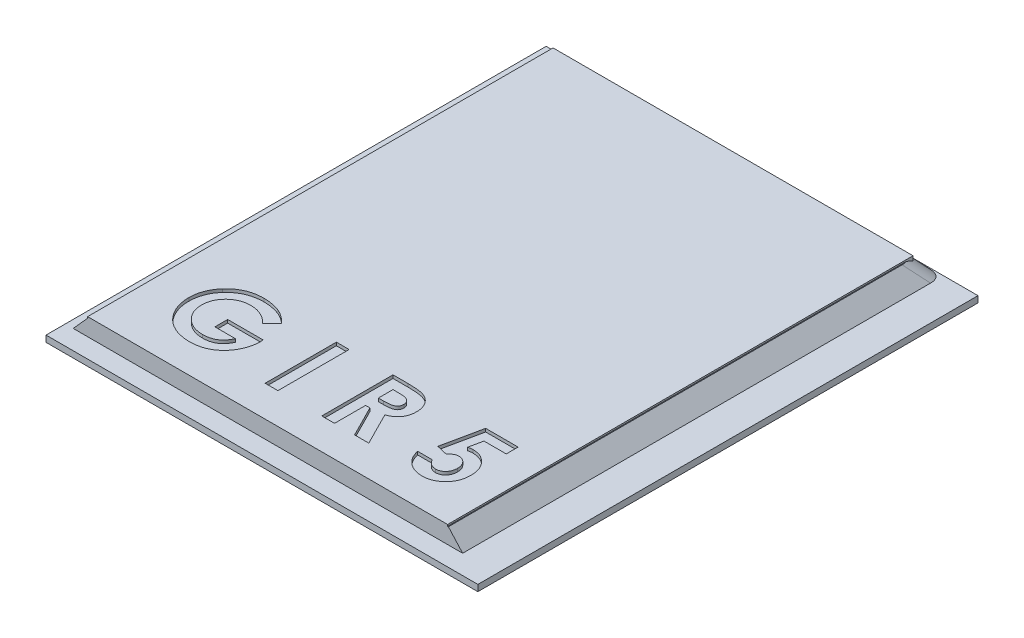
from build123d import *
from OCP.BRepAlgoAPI import BRepAlgoAPI_Cut
from OCP.TopTools import TopTools_ListOfShape

# Parameters (mm, degrees)
EXTRUDE_1_DEPTH      = 29.4
SKETCH_3_W           = 22.739
SKETCH_3_H           = 29.4
EXTRUDE_2_DEPTH      = 0.1
SKETCH_5_W           = 27.278449002
SKETCH_5_H           = 31.591708033
EXTRUDE_3_DEPTH      = 0.4
EXTRUDE_4_DEPTH      = 18.278488
EXTRUDE_4_DEPTH_BACK = 6.321512
CUT_EXTRUDE_5_DEPTH  = 10.4
FILLET_1_R           = 1
SKETCH_8_W           = 0.807692308
SKETCH_8_H           = 4.5
CUT_EXTRUDE_6_DEPTH  = 0.2


with BuildPart() as part:
    # Эскиз1 → Бобышка-Вытянуть1 (new body)
    with BuildSketch(Plane.XY):
        Polygon((0, 4.813517442), (17.378488372, 4.813517442), (18.278488372, 3.813517442), (-6.321511628, 3.813517442), (-5.421511628, 4.813517442), align=None)
    extrude(amount=EXTRUDE_1_DEPTH)

    # Эскиз3 → Бобышка-Вытянуть2 (add)
    with BuildSketch(Plane(origin=(0, 4.813517442, 0), x_dir=(1, 0, 0), z_dir=(0, 1, 0))):
        with Locations((5.957988372, -14.7)):
            Rectangle(SKETCH_3_W, SKETCH_3_H)
    extrude(amount=EXTRUDE_2_DEPTH)

    # Эскиз6 → Бобышка-Вытянуть4 (add, two sides: drawn at the far end of the back side and taken through both)
    with BuildSketch(Plane(origin=(0, 0, 0), x_dir=(0, 0, -1), z_dir=(1, 0, 0)).offset(-EXTRUDE_4_DEPTH_BACK)):
        Polygon((0, 4.813517442), (0.9, 3.809289797), (0, 3.813517442), align=None)
    extrude(amount=EXTRUDE_4_DEPTH + EXTRUDE_4_DEPTH_BACK)


with BuildPart() as body_2:
    # Эскиз5 → Бобышка-Вытянуть3 (new body)
    with BuildSketch(Plane(origin=(0, 3.593517442, 0), x_dir=(-1, 0, 0), z_dir=(0, -1, 0))):
        with Locations((-6.601803286, -14.606740346)):
            Rectangle(SKETCH_5_W, SKETCH_5_H)
    extrude(amount=EXTRUDE_3_DEPTH)


with BuildPart() as cut_extrude_5_tool:
    # Эскиз7 → Вырез-Вытянуть5 (new body)
    with BuildSketch(Plane.XY):
        Polygon((-5.421511628, 4.813517442), (-6.321511628, 3.813517442), (-6.321511628, 4.813517442), align=None)
        Polygon((17.378488372, 4.813517442), (18.278488372, 4.813517442), (18.278488372, 3.813517442), align=None)
    extrude(amount=-CUT_EXTRUDE_5_DEPTH)


with BuildPart() as part_1:
    add(part.part)

    # Вырез-Вытянуть5: cut by cut_extrude_5_tool, with a tolerance
    cut_extrude_5_stock = TopTools_ListOfShape()
    cut_extrude_5_stock.Append(part_1.part.wrapped)
    cut_extrude_5_tools = TopTools_ListOfShape()
    cut_extrude_5_tools.Append(cut_extrude_5_tool.part.wrapped)
    cut_extrude_5_cut = BRepAlgoAPI_Cut()
    cut_extrude_5_cut.SetArguments(cut_extrude_5_stock)
    cut_extrude_5_cut.SetTools(cut_extrude_5_tools)
    cut_extrude_5_cut.SetFuzzyValue(0.00001)
    cut_extrude_5_cut.Build()
    add(Compound.cast(cut_extrude_5_cut.Shape()).solids(), mode=Mode.REPLACE)

    # Скругление1
    # the kernel refuses this fillet: 1 mm, written as the material it takes off along each edge
    with BuildSketch(Plane(origin=(16.51746979, 5.770204755, 0.857393826), x_dir=(0.37087511946776647, -0.4120834660752991, 0.8322492792109453), z_dir=(0.5567454157103284, -0.6186060174559179, -0.5544016028592109))) as fillet_1_piece_1_section:
        with BuildLine():
            CenterArc((FILLET_1_R * 0.618608475228, FILLET_1_R), FILLET_1_R, 206.517427438, 63.482572562)
            Line((-FILLET_1_R * 0.276190126695, FILLET_1_R * 0.553529998772), (0, 0))
            Line((0, 0), (FILLET_1_R * 0.618608475228, 0))
        make_face()
    fillet_1_piece_1 = extrude(amount=4.709579491, mode=Mode.PRIVATE)
    fillet_1_piece_1 = split(fillet_1_piece_1, bisect_by=Plane(origin=(16.51746979, 5.770204755, 0), z_dir=(0, 0, -1)), keep=Keep.TOP, mode=Mode.PRIVATE)
    add(fillet_1_piece_1, mode=Mode.SUBTRACT)
    with BuildSketch(Plane(origin=(16.51746979, 5.770204755, 0.857393826), x_dir=(0.37087511946776647, -0.4120834660752991, 0.8322492792109453), z_dir=(0.5567454157103284, -0.6186060174559179, -0.5544016028592109))) as fillet_1_piece_2_section:
        with BuildLine():
            CenterArc((FILLET_1_R * 0.618608475228, FILLET_1_R), FILLET_1_R, 206.517427438, 63.482572562)
            Line((-FILLET_1_R * 0.276190126695, FILLET_1_R * 0.553529998772), (0, 0))
            Line((0, 0), (FILLET_1_R * 0.618608475228, 0))
        make_face()
    fillet_1_piece_2 = extrude(amount=4.709579491, mode=Mode.PRIVATE)
    fillet_1_piece_2 = split(fillet_1_piece_2, bisect_by=Plane(origin=(17.327488372, 5.770204755, 0.857393826), z_dir=(1, 0, 0)), keep=Keep.TOP, mode=Mode.PRIVATE)
    add(fillet_1_piece_2, mode=Mode.SUBTRACT)
    with BuildSketch(Plane(origin=(-7.18253021, 2.856830129, -1.753604963), x_dir=(0.8306831779237713, -0.4146058009868712, -0.3715743367113758), z_dir=(0.5567454157103263, 0.618606017455919, 0.5544016028592119))) as fillet_1_piece_3_section:
        with BuildLine():
            CenterArc((FILLET_1_R * 0.618608475228, -FILLET_1_R), FILLET_1_R, 90, 63.482572562)
            Line((-FILLET_1_R * 0.276190126695, -FILLET_1_R * 0.553529998772), (0, 0))
            Line((0, 0), (FILLET_1_R * 0.618608475228, 0))
        make_face()
    fillet_1_piece_3 = extrude(amount=4.709580159, mode=Mode.PRIVATE)
    fillet_1_piece_3 = split(fillet_1_piece_3, bisect_by=Plane(origin=(-7.18253021, 2.856830129, 0), z_dir=(0, 0, -1)), keep=Keep.TOP, mode=Mode.PRIVATE)
    add(fillet_1_piece_3, mode=Mode.SUBTRACT)
    with BuildSketch(Plane(origin=(-7.18253021, 2.856830129, -1.753604963), x_dir=(0.8306831779237713, -0.4146058009868712, -0.3715743367113758), z_dir=(0.5567454157103263, 0.618606017455919, 0.5544016028592119))) as fillet_1_piece_4_section:
        with BuildLine():
            CenterArc((FILLET_1_R * 0.618608475228, -FILLET_1_R), FILLET_1_R, 90, 63.482572562)
            Line((-FILLET_1_R * 0.276190126695, -FILLET_1_R * 0.553529998772), (0, 0))
            Line((0, 0), (FILLET_1_R * 0.618608475228, 0))
        make_face()
    fillet_1_piece_4 = extrude(amount=4.709580159, mode=Mode.PRIVATE)
    fillet_1_piece_4 = split(fillet_1_piece_4, bisect_by=Plane(origin=(-5.411511628, 2.856830129, -1.753604963), z_dir=(-1, 0, 0)), keep=Keep.TOP, mode=Mode.PRIVATE)
    add(fillet_1_piece_4, mode=Mode.SUBTRACT)

    # Эскиз8 → Вырез-Вытянуть6 (cut)
    # profile 1 of 4: a face of its own
    with BuildSketch(Plane(origin=(0, 4.913517442, 0), x_dir=(1, 0, 0), z_dir=(0, 1, 0))):
        with BuildLine():
            Line((1.098326493, -23.654828716), (0.487148608, -24.239864774))
            add(Edge.make_bspline(
                [(0.487148608, -24.239864774), (0.438760589, -24.191418777), (0.343815306, -24.096359733), (0.188544172, -23.972633854), (0.027730402, -23.867442397), (-0.139155309, -23.780946624), (-0.312345432, -23.713852982), (-0.49149819, -23.665858753), (-0.676905041, -23.637392562), (-0.802417203, -23.633407393), (-0.865916296, -23.631391216)],
                knots=[0, 0, 0, 0, 1.075575784, 2.110457258, 3.113929901, 4.09197124, 5.059417775, 6.02750972, 7.002078037, 8, 8, 8, 8], degree=3))
            add(Edge.make_bspline(
                [(-0.865916296, -23.631391216), (-0.920968068, -23.632803942), (-1.029067048, -23.635577953), (-1.187908088, -23.6566436), (-1.339690432, -23.691832817), (-1.485131161, -23.740581602), (-1.623342311, -23.804019178), (-1.755124703, -23.881166461), (-1.879667345, -23.972613635), (-1.995989555, -24.076627178), (-2.101901302, -24.190188967), (-2.194367849, -24.311740237), (-2.273129482, -24.439015375), (-2.337966369, -24.572665541), (-2.38730019, -24.712485608), (-2.422518082, -24.858374073), (-2.444872686, -25.009906964), (-2.447512097, -25.113284272), (-2.448848988, -25.165646024)],
                knots=[0, 0, 0, 0, 1.075001177, 2.110859044, 3.123021556, 4.114053297, 5.101481495, 6.087880186, 7.091499647, 8.114004866, 9.131394192, 10.11971144, 11.092043119, 12.050101265, 13.015322563, 13.981809771, 14.977764287, 16, 16, 16, 16], degree=3))
            add(Edge.make_bspline(
                [(-2.448848988, -25.165646024), (-2.447602, -25.219820086), (-2.445145263, -25.326550405), (-2.421545529, -25.483181737), (-2.385186075, -25.633872365), (-2.331965529, -25.777504199), (-2.266467154, -25.916044796), (-2.183404424, -26.046810492), (-2.086544968, -26.171798223), (-1.976061862, -26.28883188), (-1.855884773, -26.396708747), (-1.725729076, -26.489766108), (-1.589554905, -26.570054524), (-1.445164403, -26.633640354), (-1.295063761, -26.68469281), (-1.137730527, -26.720689173), (-0.973518979, -26.742772816), (-0.861478919, -26.74542821), (-0.804618219, -26.746775832)],
                knots=[0, 0, 0, 0, 1.022067601, 2.013613092, 2.983553406, 3.943623673, 4.90013463, 5.87121881, 6.861774014, 7.881098904, 8.905697761, 9.905387765, 10.89678721, 11.884561068, 12.87834324, 13.885584958, 14.926927371, 16, 16, 16, 16], degree=3))
            add(Edge.make_bspline(
                [(-0.804618219, -26.746775832), (-0.767632439, -26.746442115), (-0.695021123, -26.745786956), (-0.588512696, -26.735151877), (-0.486503206, -26.719947796), (-0.388597597, -26.699819398), (-0.295784454, -26.671334103), (-0.206778714, -26.638024058), (-0.122101874, -26.598711563), (-0.042213042, -26.552040264), (0.034076759, -26.499727443), (0.106053442, -26.439870451), (0.174979563, -26.373818843), (0.240049729, -26.300765706), (0.300162608, -26.220057857), (0.357244064, -26.133178412), (0.410640525, -26.039265145), (0.442191085, -25.972948352), (0.458302454, -25.939083524)],
                knots=[0, 0, 0, 0, 1.109579412, 2.178351274, 3.208885622, 4.204702371, 5.174744997, 6.119429583, 7.05542196, 7.97267548, 8.893247984, 9.828544973, 10.778894627, 11.756245826, 12.760884819, 13.796418446, 14.874735809, 16, 16, 16, 16], degree=3))
            Line((0.458302454, -25.939083524), (-0.833464373, -25.939083524))
            Line((-0.833464373, -25.939083524), (-0.833464373, -25.131391216))
            Line((-0.833464373, -25.131391216), (1.410225531, -25.131391216))
            Line((1.410225531, -25.131391216), (1.416535627, -25.323398428))
            add(Edge.make_bspline(
                [(1.416535627, -25.323398428), (1.415724827, -25.372710751), (1.414104673, -25.471247397), (1.399298166, -25.617951675), (1.374771413, -25.762710225), (1.341240994, -25.905377656), (1.299218896, -26.046653801), (1.245627568, -26.185185825), (1.182872449, -26.321913205), (1.112559791, -26.456254956), (1.033548595, -26.585159519), (0.94848144, -26.707215124), (0.858571017, -26.822210518), (0.761861812, -26.928543528), (0.659859746, -27.027107399), (0.552364027, -27.117522942), (0.438994449, -27.199866662), (0.320351574, -27.274834173), (0.195759618, -27.340538774), (0.065903586, -27.39769306), (-0.069020456, -27.446232988), (-0.20936085, -27.48602517), (-0.354841441, -27.516728004), (-0.505465347, -27.537780978), (-0.661315291, -27.55208671), (-0.767025012, -27.553664733), (-0.82084418, -27.554468139)],
                knots=[0, 0, 0, 0, 1.006889344, 2.011981806, 3.007738725, 4.003571281, 5.003404394, 6.015442001, 7.03424805, 8.074616296, 9.110249922, 10.119753985, 11.111721717, 12.089233633, 13.052717867, 14.006597561, 14.955430184, 15.912305663, 16.870361111, 17.829300583, 18.807640451, 19.796414044, 20.806216501, 21.841577364, 22.90109906, 24, 24, 24, 24], degree=3))
            add(Edge.make_bspline(
                [(-0.82084418, -27.554468139), (-0.878265584, -27.55367476), (-0.992091933, -27.552102047), (-1.160399445, -27.537372513), (-1.323824252, -27.513062369), (-1.482407115, -27.47941796), (-1.636516232, -27.437544806), (-1.785886819, -27.384984092), (-1.930213374, -27.322461461), (-2.069928086, -27.251632536), (-2.20324525, -27.171306366), (-2.329866079, -27.082891478), (-2.449099455, -26.985819142), (-2.562166696, -26.881714368), (-2.666426114, -26.768018251), (-2.765763051, -26.648416235), (-2.855364971, -26.518521793), (-2.939084492, -26.382546143), (-3.013461584, -26.240546266), (-3.078505419, -26.095148521), (-3.133974765, -25.947194763), (-3.177713686, -25.795996069), (-3.213225592, -25.642606724), (-3.238635028, -25.486359673), (-3.252984924, -25.327274474), (-3.255350576, -25.220360979), (-3.256541296, -25.166547466)],
                knots=[0, 0, 0, 0, 1.084149091, 2.14910686, 3.187506334, 4.202448172, 5.208724393, 6.201130722, 7.189831603, 8.176984443, 9.156919086, 10.126598231, 11.090766514, 12.05840148, 13.026036446, 14.001772938, 14.991905635, 16.003017641, 17.015720547, 18.016462227, 19.009322657, 19.99686681, 20.986544154, 21.980959929, 22.983742515, 24, 24, 24, 24], degree=3))
            add(Edge.make_bspline(
                [(-3.256541296, -25.166547466), (-3.254946667, -25.093134335), (-3.251797749, -24.948165166), (-3.222633988, -24.73462466), (-3.17717203, -24.528045528), (-3.111929543, -24.329180116), (-3.028208025, -24.137754486), (-2.927193468, -23.953319256), (-2.806691616, -23.776070465), (-2.713414906, -23.666328845), (-2.666096584, -23.610658043)],
                knots=[0, 0, 0, 0, 1.034044851, 2.041932006, 3.031217818, 4.011390712, 4.986069675, 5.97149666, 6.970960976, 8, 8, 8, 8], degree=3))
            add(Edge.make_bspline(
                [(-2.666096584, -23.610658043), (-2.6367171, -23.578450796), (-2.578399267, -23.514519896), (-2.485178316, -23.42568661), (-2.389593256, -23.342180034), (-2.290320218, -23.265770874), (-2.187881062, -23.194786496), (-2.081980951, -23.130557558), (-1.973175411, -23.071038978), (-1.860615892, -23.01927), (-1.744891657, -22.972854792), (-1.625490184, -22.933581), (-1.503305763, -22.898793756), (-1.377256448, -22.872329584), (-1.248615638, -22.850292242), (-1.116470198, -22.835521662), (-0.981180231, -22.824695877), (-0.889676901, -22.82403386), (-0.843380238, -22.823698908)],
                knots=[0, 0, 0, 0, 1.020590567, 2.025856924, 3.013483481, 3.991664875, 4.957826714, 5.930500614, 6.890802512, 7.860442893, 8.829981142, 9.809047939, 10.802672283, 11.803273349, 12.823572789, 13.857849586, 14.916166035, 16, 16, 16, 16], degree=3))
            add(Edge.make_bspline(
                [(-0.843380238, -22.823698908), (-0.794985194, -22.824445243), (-0.698696827, -22.825930176), (-0.55553197, -22.836204938), (-0.414356485, -22.852056474), (-0.275765299, -22.875834683), (-0.139293299, -22.905158164), (-0.005646897, -22.942728801), (0.126045784, -22.985415812), (0.21177722, -23.019449051), (0.254576493, -23.036439293)],
                knots=[0, 0, 0, 0, 1.03180557, 2.052914215, 3.058998889, 4.059601663, 5.049854447, 6.033765722, 7.018406786, 8, 8, 8, 8], degree=3))
            add(Edge.make_bspline(
                [(0.254576493, -23.036439293), (0.290586786, -23.052141335), (0.363830727, -23.084078854), (0.470391633, -23.142510043), (0.577212897, -23.207287722), (0.683141862, -23.280780313), (0.788017123, -23.362850352), (0.89293369, -23.452201556), (0.996820535, -23.549875811), (1.064052982, -23.619391343), (1.098326493, -23.654828716)],
                knots=[0, 0, 0, 0, 0.894392155, 1.819168899, 2.76525314, 3.739198753, 4.75366411, 5.797420238, 6.877176959, 8, 8, 8, 8], degree=3))
        make_face()
    # profile 2 of 4: a face of its own
    with BuildSketch(Plane(origin=(0, 4.913517442, 0), x_dir=(1, 0, 0), z_dir=(0, 1, 0))):
        with Locations((4.243458704, -25.189083524)):
            Rectangle(SKETCH_8_W, SKETCH_8_H)
    # profile 3 of 4: a face of its own
    with BuildSketch(Plane(origin=(0, 4.913517442, 0), x_dir=(1, 0, 0), z_dir=(0, 1, 0))):
        with BuildLine():
            Line((7.416535627, -22.939083524), (8.357641397, -22.939083524))
            add(Edge.make_bspline(
                [(8.357641397, -22.939083524), (8.419848202, -22.939304322), (8.53948941, -22.93972898), (8.712005498, -22.946428952), (8.87048525, -22.955752514), (9.015163309, -22.969980517), (9.145977779, -22.988845128), (9.263059768, -23.011083383), (9.366405853, -23.036428643), (9.456887615, -23.068010836), (9.538542932, -23.103635071), (9.614657039, -23.14456797), (9.686909127, -23.190353733), (9.754816269, -23.242197107), (9.818968595, -23.299165442), (9.87948713, -23.361316082), (9.935516693, -23.42917604), (9.986710345, -23.502316526), (10.033369239, -23.579258641), (10.074605915, -23.660108025), (10.108139648, -23.744920905), (10.137770296, -23.832471551), (10.159112292, -23.924011517), (10.173955338, -24.018649645), (10.184822835, -24.116719072), (10.185447665, -24.183343087), (10.185766397, -24.217328716)],
                knots=[0, 0, 0, 0, 1.749336639, 3.364467119, 4.854658419, 6.213483162, 7.451590619, 8.570285859, 9.5643256, 10.440900261, 11.26203566, 12.067320669, 12.869050712, 13.665104639, 14.467235401, 15.27997916, 16.102287765, 16.939272006, 17.78853747, 18.631303466, 19.488103222, 20.351255419, 21.228522269, 22.127379805, 23.044756219, 24, 24, 24, 24], degree=3))
            add(Edge.make_bspline(
                [(10.185766397, -24.217328716), (10.184938445, -24.252801906), (10.183314984, -24.322358365), (10.174570135, -24.424531131), (10.1585873, -24.522282887), (10.134378971, -24.615327428), (10.106554641, -24.704822801), (10.069555419, -24.789117761), (10.02779814, -24.869438256), (9.97820424, -24.944648122), (9.923777358, -25.016417921), (9.860480039, -25.081997884), (9.792412977, -25.144912688), (9.715749875, -25.201221562), (9.633870113, -25.254731909), (9.545146826, -25.303226534), (9.450159055, -25.347924479), (9.383377947, -25.372851141), (9.349227935, -25.385597947)],
                knots=[0, 0, 0, 0, 1.099860209, 2.156625411, 3.176576793, 4.16617041, 5.135385252, 6.078461593, 7.016046972, 7.938469504, 8.868247731, 9.803980173, 10.76021508, 11.73834243, 12.748633912, 13.790971185, 14.870363756, 16, 16, 16, 16], degree=3))
            Line((9.349227935, -25.385597947), (10.387689474, -27.439083524))
            Line((10.387689474, -27.439083524), (9.489852935, -27.439083524))
            Line((9.489852935, -27.439083524), (8.498266397, -25.477545062))
            Line((8.498266397, -25.477545062), (8.224227935, -25.477545062))
            Line((8.224227935, -25.477545062), (8.224227935, -27.439083524))
            Line((8.224227935, -27.439083524), (7.416535627, -27.439083524))
            Line((7.416535627, -27.439083524), (7.416535627, -22.939083524))
        make_face()
        with BuildLine():
            Line((8.224227935, -24.669852755), (8.5388313, -24.669852755))
            add(Edge.make_bspline(
                [(8.5388313, -24.669852755), (8.577294177, -24.66941956), (8.650942321, -24.668590085), (8.756858025, -24.664742637), (8.853054744, -24.655472187), (8.939945579, -24.643759321), (9.017967756, -24.630235125), (9.086425346, -24.610854131), (9.146373176, -24.590086906), (9.19710086, -24.564278632), (9.240441429, -24.534929027), (9.277863235, -24.501587146), (9.308816435, -24.462998164), (9.334292497, -24.420210763), (9.354110104, -24.3728465), (9.368575439, -24.321425326), (9.376659422, -24.265361489), (9.377589511, -24.226669807), (9.378074089, -24.206511408)],
                knots=[0, 0, 0, 0, 1.688639943, 3.233382647, 4.650958383, 5.928841754, 7.082724185, 8.122798841, 9.049171256, 9.863274652, 10.613301712, 11.341792392, 12.054588806, 12.776240173, 13.521029143, 14.301969904, 15.115324896, 16, 16, 16, 16], degree=3))
            add(Edge.make_bspline(
                [(9.378074089, -24.206511408), (9.377157951, -24.182662551), (9.375358367, -24.135815891), (9.357500904, -24.068373126), (9.329075682, -24.005950233), (9.290112486, -23.948829254), (9.241043408, -23.89875306), (9.184732769, -23.854610497), (9.119965249, -23.819705861), (9.0599954, -23.796683134), (9.005436855, -23.7829084), (8.95619949, -23.772643589), (8.899182324, -23.765368623), (8.834342313, -23.757652227), (8.761844736, -23.752648535), (8.681294439, -23.748996837), (8.59292276, -23.747502748), (8.531319307, -23.747025114), (8.499167839, -23.746775832)],
                knots=[0, 0, 0, 0, 1.020303359, 2.004196876, 2.966617323, 3.9489082, 4.950758222, 5.960522915, 7.003732012, 8.091992268, 8.70421221, 9.413913587, 10.24622431, 11.166358409, 12.212345909, 13.359657661, 14.621978493, 16, 16, 16, 16], degree=3))
            Line((8.499167839, -23.746775832), (8.224227935, -23.746775832))
            Line((8.224227935, -23.746775832), (8.224227935, -24.669852755))
        make_face(mode=Mode.SUBTRACT)
    # profile 4 of 4: a face of its own
    with BuildSketch(Plane(origin=(0, 4.913517442, 0), x_dir=(1, 0, 0), z_dir=(0, 1, 0))):
        with BuildLine():
            Line((13.271403416, -22.939083524), (15.320381781, -22.939083524))
            Line((15.320381781, -22.939083524), (15.320381781, -23.689083524))
            Line((15.320381781, -23.689083524), (13.911427454, -23.689083524))
            Line((13.911427454, -23.689083524), (13.735646204, -24.540045062))
            add(Edge.make_bspline(
                [(13.735646204, -24.540045062), (13.759598916, -24.53337393), (13.806838584, -24.520217086), (13.878005204, -24.507022436), (13.946975575, -24.498470083), (13.992233513, -24.497329313), (14.014191877, -24.496775832)],
                knots=[0, 0, 0, 0, 1.05461699, 2.079921384, 3.068411212, 4, 4, 4, 4], degree=3))
            add(Edge.make_bspline(
                [(14.014191877, -24.496775832), (14.062041455, -24.497872277), (14.156363512, -24.500033612), (14.294344713, -24.520551734), (14.426469865, -24.552867154), (14.552334648, -24.59895561), (14.671816112, -24.658940926), (14.78505909, -24.731506343), (14.892202569, -24.816779313), (14.99134323, -24.914813223), (15.082437811, -25.022456676), (15.161639353, -25.138884461), (15.229282413, -25.26243643), (15.283083364, -25.393880579), (15.325547662, -25.532391352), (15.356233311, -25.67805751), (15.374379269, -25.831051689), (15.37682614, -25.935428679), (15.378074089, -25.988662851)],
                knots=[0, 0, 0, 0, 1.01440847, 1.999622559, 2.951875003, 3.895578053, 4.836219714, 5.782137149, 6.743708247, 7.735272588, 8.734977101, 9.730283169, 10.717124674, 11.717316708, 12.737475749, 13.78628267, 14.87096371, 16, 16, 16, 16], degree=3))
            add(Edge.make_bspline(
                [(15.378074089, -25.988662851), (15.376549075, -26.042501354), (15.373539777, -26.148740458), (15.353906866, -26.304949521), (15.319254426, -26.454562539), (15.271655832, -26.597980022), (15.208947731, -26.734147886), (15.133532658, -26.864476728), (15.044135546, -26.987999159), (14.941633688, -27.103448924), (14.830200722, -27.208972226), (14.711550919, -27.301801277), (14.586517828, -27.379916172), (14.455098432, -27.443046213), (14.318046727, -27.492993577), (14.175321116, -27.529352874), (14.02622797, -27.550202911), (13.925013096, -27.553030773), (13.873566877, -27.554468139)],
                knots=[0, 0, 0, 0, 1.06808661, 2.107647099, 3.116961351, 4.110378221, 5.100014249, 6.085620622, 7.093190682, 8.119403071, 9.144090782, 10.133780668, 11.103064255, 12.062861538, 13.020824475, 13.992378307, 14.979551724, 16, 16, 16, 16], degree=3))
            add(Edge.make_bspline(
                [(13.873566877, -27.554468139), (13.827560056, -27.553292284), (13.736824975, -27.550973253), (13.603176186, -27.536719262), (13.474323911, -27.511518072), (13.350952216, -27.475045425), (13.231763024, -27.430155923), (13.118134197, -27.374013118), (13.009441324, -27.307686043), (12.905993052, -27.232385171), (12.80947027, -27.147561659), (12.721374501, -27.05470771), (12.641172404, -26.954993703), (12.570580177, -26.84718947), (12.509819107, -26.731454287), (12.45593495, -26.609152118), (12.411830228, -26.479005739), (12.389448352, -26.388781039), (12.378074089, -26.342929678)],
                knots=[0, 0, 0, 0, 1.054957082, 2.080596141, 3.077793124, 4.061112343, 5.027190972, 5.994718051, 6.962465889, 7.943658696, 8.924948258, 9.904494768, 10.875059, 11.855380583, 12.854004648, 13.869083016, 14.917087635, 16, 16, 16, 16], degree=3))
            Line((12.378074089, -26.342929678), (13.301151012, -26.342929678))
            add(Edge.make_bspline(
                [(13.301151012, -26.342929678), (13.31802488, -26.374702804), (13.350817318, -26.436450248), (13.413195784, -26.518429259), (13.483024517, -26.588337437), (13.559673623, -26.646857801), (13.643639741, -26.690700262), (13.73150141, -26.723948356), (13.824362399, -26.743161198), (13.887604833, -26.745562994), (13.919540435, -26.746775832)],
                knots=[0, 0, 0, 0, 1.104910296, 2.147267069, 3.153527244, 4.136738762, 5.099945312, 6.05603338, 7.018353, 8, 8, 8, 8], degree=3))
            add(Edge.make_bspline(
                [(13.919540435, -26.746775832), (13.941799122, -26.745938357), (13.985593462, -26.744290611), (14.050117498, -26.735573621), (14.111708525, -26.719063841), (14.170824458, -26.696201634), (14.227624097, -26.667689879), (14.2812932, -26.631695646), (14.332765511, -26.590264949), (14.381257415, -26.542723084), (14.425177103, -26.489724963), (14.463689865, -26.432774869), (14.498125585, -26.373138246), (14.523632649, -26.308452737), (14.544520778, -26.240649874), (14.559903641, -26.1692182), (14.569096637, -26.094074288), (14.569947662, -26.042775646), (14.570381781, -26.016607562)],
                knots=[0, 0, 0, 0, 0.978869489, 1.925942215, 2.855067702, 3.774946051, 4.70828698, 5.642468714, 6.60995405, 7.609372294, 8.622401667, 9.629904756, 10.629323, 11.642352373, 12.678539694, 13.745912462, 14.850161547, 16, 16, 16, 16], degree=3))
            add(Edge.make_bspline(
                [(14.570381781, -26.016607562), (14.569877936, -25.991046899), (14.568897189, -25.941292448), (14.560784257, -25.868235092), (14.546270376, -25.798916882), (14.52649509, -25.732806894), (14.501180362, -25.670306578), (14.470244073, -25.611043903), (14.433554059, -25.555318421), (14.390913339, -25.504264646), (14.345441714, -25.457436673), (14.296590578, -25.4164813), (14.244800053, -25.382491184), (14.191679465, -25.352816824), (14.135108434, -25.331220472), (14.076359012, -25.316347861), (14.015492985, -25.305434937), (13.973977588, -25.304793763), (13.9528938, -25.304468139)],
                knots=[0, 0, 0, 0, 1.166249705, 2.270133367, 3.348514167, 4.393962215, 5.415026464, 6.420877785, 7.440098956, 8.453121383, 9.451844239, 10.415694839, 11.355045125, 12.27538808, 13.187007209, 14.108269027, 15.039275622, 16, 16, 16, 16], degree=3))
            add(Edge.make_bspline(
                [(13.9528938, -25.304468139), (13.929991907, -25.305337139), (13.8840916, -25.307078801), (13.815895231, -25.321250236), (13.748521121, -25.344184935), (13.6815946, -25.375826988), (13.615780031, -25.41723645), (13.549340533, -25.465805002), (13.48449998, -25.525061609), (13.443272553, -25.569196064), (13.421944281, -25.592028235)],
                knots=[0, 0, 0, 0, 0.88288272, 1.769486374, 2.674910571, 3.623812639, 4.617874466, 5.670434592, 6.794841017, 8, 8, 8, 8], degree=3))
            Line((13.421944281, -25.592028235), (12.742256781, -25.436078716))
            Line((12.742256781, -25.436078716), (13.271403416, -22.939083524))
        make_face()
    extrude(amount=-CUT_EXTRUDE_6_DEPTH, mode=Mode.SUBTRACT)


solid = Compound([body_2.part, part_1.part])
